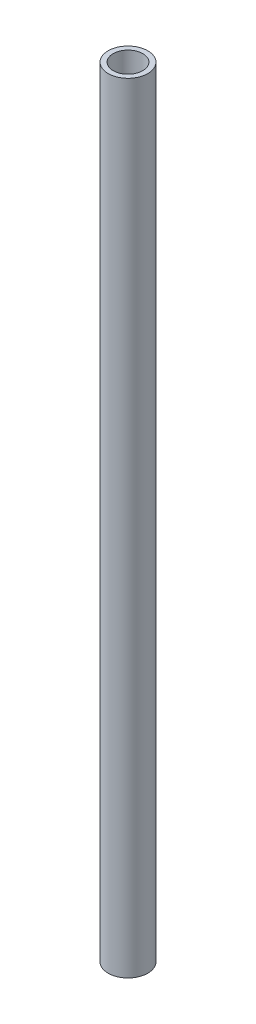
from build123d import *

# Parameters (mm, degrees)
SKETCH1_R           = 12.7
SKETCH1_R_2         = 9.5
BOSS_EXTRUDE1_DEPTH = 500


with BuildPart() as part:
    # Sketch1 → Boss-Extrude1 (new body)
    with BuildSketch(Plane(origin=(0, 0, 0), x_dir=(1, 0, 0), z_dir=(0, 1, 0))):
        Circle(SKETCH1_R)
        Circle(SKETCH1_R_2, mode=Mode.SUBTRACT)
    extrude(amount=BOSS_EXTRUDE1_DEPTH)


solid = part.part
